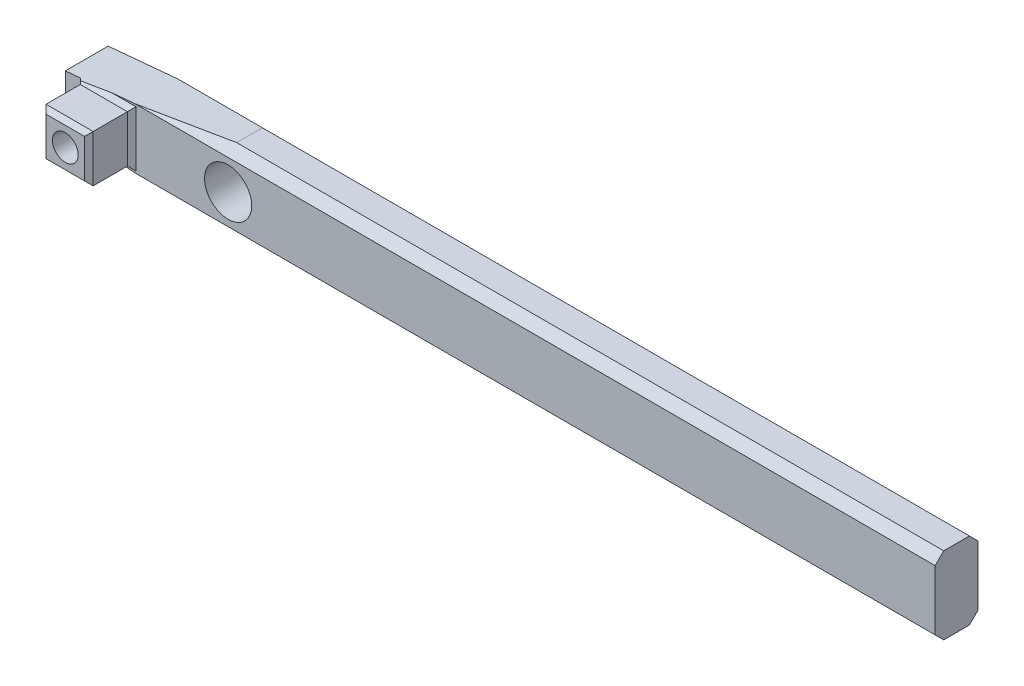
from build123d import *

# Parameters (mm, degrees)
SKETCH1_R           = 2.75
BOSS_EXTRUDE1_DEPTH = 5
CHAMFER1_SIZE       = 1
SKETCH2_R           = 1.5
CUT_EXTRUDE1_DEPTH  = 83.773788122
BOSS_EXTRUDE2_START = 5
SKETCH3_W           = 5.5
SKETCH3_H           = 5.5
SKETCH3_W_2         = 3
SKETCH3_H_2         = 3
BOSS_EXTRUDE2_DEPTH = 5
CHAMFER3_SIZE       = 0.5


with BuildPart() as part:
    # Sketch1 → Boss-Extrude1 (new body)
    with BuildSketch(Plane.XY):
        Polygon((82.5, 4.5), (82.5, -4.5), (0, -4.5), (-19, -2.75), (-19, 2.75), (0, 4.5), align=None)
        Circle(SKETCH1_R, mode=Mode.SUBTRACT)
    extrude(amount=BOSS_EXTRUDE1_DEPTH)

    # Chamfer1
    # the kernel refuses this chamfer: 1 mm, written as the material it takes off along each edge
    with BuildSketch(Plane(origin=(-12.85841494, 4.5, 5), x_dir=(0, 0, -1), z_dir=(1, 0, 0)), Plane(origin=(85.071682988, -4.5, 5), x_dir=(0, 0, -1), z_dir=(-1, 0, 0))) as chamfer1_piece_1:
        Polygon((CHAMFER1_SIZE, 0), (0, -CHAMFER1_SIZE), (0, 0), align=None)
    extrude(amount=97.930097928, mode=Mode.SUBTRACT)
    with BuildSketch(Plane(origin=(-12.85841494, 4.5, 0), x_dir=(0, 0, 1), z_dir=(1, 0, 0)), Plane(origin=(85.071682988, -4.5, 0), x_dir=(0, 0, 1), z_dir=(-1, 0, 0))) as chamfer1_piece_2:
        Polygon((CHAMFER1_SIZE, 0), (0, CHAMFER1_SIZE), (0, 0), align=None)
    extrude(amount=97.930097928, mode=Mode.SUBTRACT)

    # Sketch2 → Cut-Extrude1 (cut, through all)
    with BuildSketch(Plane.XY.offset(5)):
        with Locations((-14, 0)):
            Circle(SKETCH2_R)
    extrude(amount=-CUT_EXTRUDE1_DEPTH, mode=Mode.SUBTRACT)

    # Sketch3 → Boss-Extrude2 (add)
    # profile 1 of 5: a face of its own
    with BuildSketch(Plane.XY.offset(5).offset(BOSS_EXTRUDE2_START)):
        with Locations((-14, 0)):
            Rectangle(SKETCH3_W, SKETCH3_H)
        with Locations((-14, 0)):
            Rectangle(SKETCH3_W_2, SKETCH3_H_2, mode=Mode.SUBTRACT)
    # profile 2 of 5: a face of its own
    with BuildSketch(Plane.XY.offset(5).offset(BOSS_EXTRUDE2_START)):
        with BuildLine():
            Line((-15.5, 1.5), (-15.5, 3e-09))
            ThreePointArc((-15.5, 3e-09), (-15.060660171, 1.060660173), (-14, 1.5))
            Line((-14, 1.5), (-15.5, 1.5))
        make_face()
    # profile 3 of 5: a face of its own
    with BuildSketch(Plane.XY.offset(5).offset(BOSS_EXTRUDE2_START)):
        with BuildLine():
            Line((-15.5, 3e-09), (-15.5, -1.5))
            Line((-15.5, -1.5), (-14, -1.5))
            ThreePointArc((-14, -1.5), (-15.060660173, -1.060660171), (-15.5, 3e-09))
        make_face()
    # profile 4 of 5: a face of its own
    with BuildSketch(Plane.XY.offset(5).offset(BOSS_EXTRUDE2_START)):
        with BuildLine():
            ThreePointArc((-12.5, 0), (-12.939339828, -1.060660172), (-14, -1.5))
            Line((-14, -1.5), (-12.5, -1.5))
            Line((-12.5, -1.5), (-12.5, 0))
        make_face()
    # profile 5 of 5: a face of its own
    with BuildSketch(Plane.XY.offset(5).offset(BOSS_EXTRUDE2_START)):
        with BuildLine():
            ThreePointArc((-14, 1.5), (-12.939339828, 1.060660172), (-12.5, 0))
            Line((-12.5, 0), (-12.5, 1.5))
            Line((-12.5, 1.5), (-14, 1.5))
        make_face()
    extrude(amount=-BOSS_EXTRUDE2_DEPTH)

    # Chamfer3
    # the kernel refuses this chamfer: 0.5 mm, written as the material it adds along each edge
    with BuildSketch(Plane(origin=(-16.75, -2.75, 5), x_dir=(0, -1, 0), z_dir=(1, 0, 0))) as chamfer3_piece_1_section:
        Polygon((CHAMFER3_SIZE, 0), (0, -CHAMFER3_SIZE), (0, 0), align=None)
    chamfer3_piece_1 = extrude(amount=5.5, mode=Mode.PRIVATE)
    chamfer3_piece_1 = split(chamfer3_piece_1, bisect_by=Plane(origin=(-16.768927039, -2.955493562, 5), z_dir=(0.09171704949125846, 0.995785108762236, 0)), keep=Keep.TOP, mode=Mode.PRIVATE)
    add(chamfer3_piece_1)
    with BuildSketch(Plane(origin=(-11.25, -2.75, 5), x_dir=(1, 0, 0), z_dir=(0, 1, 0)), Plane(origin=(-16.75, 2.75, 5), x_dir=(-1, 0, 0), z_dir=(0, -1, 0))) as chamfer3_piece_2:
        Polygon((CHAMFER3_SIZE, 0), (0, -CHAMFER3_SIZE), (0, 0), align=None)
    extrude(amount=5.5)
    with BuildSketch(Plane(origin=(-11.25, 2.75, 5), x_dir=(0, 1, 0), z_dir=(-1, 0, 0))) as chamfer3_piece_3_section:
        Polygon((CHAMFER3_SIZE, 0), (0, -CHAMFER3_SIZE), (0, 0), align=None)
    chamfer3_piece_3 = extrude(amount=5.5, mode=Mode.PRIVATE)
    chamfer3_piece_3 = split(chamfer3_piece_3, bisect_by=Plane(origin=(-11.315193133, 3.457811159, 5), z_dir=(0.09171704949125607, -0.9957851087622361, 0)), keep=Keep.TOP, mode=Mode.PRIVATE)
    add(chamfer3_piece_3)
    with BuildSketch(Plane(origin=(-16.75, 2.75, 5), x_dir=(-1, 0, 0), z_dir=(0, -1, 0))) as chamfer3_piece_4a_section:
        Polygon((CHAMFER3_SIZE, 0), (0, -CHAMFER3_SIZE), (0, 0), align=None)
    chamfer3_piece_4a = extrude(amount=6.785841494, mode=Mode.PRIVATE)
    chamfer3_piece_4a = split(chamfer3_piece_4a, bisect_by=Plane(origin=(-17.271244635, -2.909227468, 5), z_dir=(0.09171704949125846, 0.995785108762236, 0)), keep=Keep.TOP, mode=Mode.PRIVATE)
    chamfer3_piece_4a = split(chamfer3_piece_4a, bisect_by=Plane(origin=(-16.75, -2.75, 5), z_dir=(0, -1, 0)), keep=Keep.TOP, mode=Mode.PRIVATE)
    with BuildSketch(Plane(origin=(-18.035841494, -2.75, 5), x_dir=(0, -1, 0), z_dir=(1, 0, 0))) as chamfer3_piece_4b_section:
        Polygon((CHAMFER3_SIZE, 0), (0, -CHAMFER3_SIZE), (0, 0), align=None)
    chamfer3_piece_4b = extrude(amount=6.785841494, mode=Mode.PRIVATE)
    chamfer3_piece_4b = split(chamfer3_piece_4b, bisect_by=Plane(origin=(-18.043952012, -2.838057052, 5), z_dir=(0.09171704949125846, 0.995785108762236, 0)), keep=Keep.TOP, mode=Mode.PRIVATE)
    chamfer3_piece_4b = split(chamfer3_piece_4b, bisect_by=Plane(origin=(-16.75, -2.75, 5), z_dir=(-1, 0, 0)), keep=Keep.TOP, mode=Mode.PRIVATE)
    chamfer3_piece_4 = chamfer3_piece_4a & chamfer3_piece_4b
    add(chamfer3_piece_4)
    with BuildSketch(Plane(origin=(-11.25, -4.035841494, 5), x_dir=(1, 0, 0), z_dir=(0, 1, 0))) as chamfer3_piece_5a_section:
        Polygon((CHAMFER3_SIZE, 0), (0, -CHAMFER3_SIZE), (0, 0), align=None)
    chamfer3_piece_5a = extrude(amount=6.785841494, mode=Mode.PRIVATE)
    chamfer3_piece_5a = split(chamfer3_piece_5a, bisect_by=Plane(origin=(-11.25, -3.767920747, 4.732079253), z_dir=(0, 0.7071067811865476, -0.7071067811865476)), keep=Keep.TOP, mode=Mode.PRIVATE)
    chamfer3_piece_5a = split(chamfer3_piece_5a, bisect_by=Plane(origin=(-11.197756622, -3.46862768, 5), z_dir=(0.09171704949125846, 0.995785108762236, 0)), keep=Keep.TOP, mode=Mode.PRIVATE)
    chamfer3_piece_5a = split(chamfer3_piece_5a, bisect_by=Plane(origin=(-11.25, -2.75, 5), z_dir=(0, -1, 0)), keep=Keep.TOP, mode=Mode.PRIVATE)
    with BuildSketch(Plane(origin=(-16.75, -2.75, 5), x_dir=(0, -1, 0), z_dir=(1, 0, 0))) as chamfer3_piece_5b_section:
        Polygon((CHAMFER3_SIZE, 0), (0, -CHAMFER3_SIZE), (0, 0), align=None)
    chamfer3_piece_5b = extrude(amount=6.785841494, mode=Mode.PRIVATE)
    chamfer3_piece_5b = split(chamfer3_piece_5b, bisect_by=Plane(origin=(-11.25, -2.75, 5), z_dir=(1, 0, 0)), keep=Keep.TOP, mode=Mode.PRIVATE)
    chamfer3_piece_5 = chamfer3_piece_5a & chamfer3_piece_5b
    add(chamfer3_piece_5)
    with BuildSketch(Plane(origin=(-9.964158506, 2.75, 5), x_dir=(0, 1, 0), z_dir=(-1, 0, 0))) as chamfer3_piece_6a_section:
        Polygon((CHAMFER3_SIZE, 0), (0, -CHAMFER3_SIZE), (0, 0), align=None)
    chamfer3_piece_6a = extrude(amount=6.785841494, mode=Mode.PRIVATE)
    chamfer3_piece_6a = split(chamfer3_piece_6a, bisect_by=Plane(origin=(-11.25, 2.75, 5), z_dir=(1, 0, 0)), keep=Keep.TOP, mode=Mode.PRIVATE)
    with BuildSketch(Plane(origin=(-11.25, -2.75, 5), x_dir=(1, 0, 0), z_dir=(0, 1, 0))) as chamfer3_piece_6b_section:
        Polygon((CHAMFER3_SIZE, 0), (0, -CHAMFER3_SIZE), (0, 0), align=None)
    chamfer3_piece_6b = extrude(amount=6.785841494, mode=Mode.PRIVATE)
    chamfer3_piece_6b = split(chamfer3_piece_6b, bisect_by=Plane(origin=(-11.25, 0.375, 8.125), z_dir=(0, -0.7071067811865476, -0.7071067811865476)), keep=Keep.TOP, mode=Mode.PRIVATE)
    chamfer3_piece_6b = split(chamfer3_piece_6b, bisect_by=Plane(origin=(-11.81751073, 3.411545064, 5), z_dir=(0.09171704949125607, -0.9957851087622361, 0)), keep=Keep.TOP, mode=Mode.PRIVATE)
    chamfer3_piece_6b = split(chamfer3_piece_6b, bisect_by=Plane(origin=(-11.25, 2.75, 5), z_dir=(0, 1, 0)), keep=Keep.TOP, mode=Mode.PRIVATE)
    chamfer3_piece_6 = chamfer3_piece_6a & chamfer3_piece_6b
    add(chamfer3_piece_6)
    with BuildSketch(Plane(origin=(-16.75, 4.035841494, 5), x_dir=(-1, 0, 0), z_dir=(0, -1, 0))) as chamfer3_piece_7a_section:
        Polygon((CHAMFER3_SIZE, 0), (0, -CHAMFER3_SIZE), (0, 0), align=None)
    chamfer3_piece_7a = extrude(amount=6.785841494, mode=Mode.PRIVATE)
    chamfer3_piece_7a = split(chamfer3_piece_7a, bisect_by=Plane(origin=(-16.651490528, 2.966310083, 5), z_dir=(0.09171704949125607, -0.9957851087622361, 0)), keep=Keep.TOP, mode=Mode.PRIVATE)
    chamfer3_piece_7a = split(chamfer3_piece_7a, bisect_by=Plane(origin=(-16.75, 2.75, 5), z_dir=(0, 1, 0)), keep=Keep.TOP, mode=Mode.PRIVATE)
    with BuildSketch(Plane(origin=(-11.25, 2.75, 5), x_dir=(0, 1, 0), z_dir=(-1, 0, 0))) as chamfer3_piece_7b_section:
        Polygon((CHAMFER3_SIZE, 0), (0, -CHAMFER3_SIZE), (0, 0), align=None)
    chamfer3_piece_7b = extrude(amount=6.785841494, mode=Mode.PRIVATE)
    chamfer3_piece_7b = split(chamfer3_piece_7b, bisect_by=Plane(origin=(-11.315193133, 3.457811159, 5), z_dir=(0.09171704949125607, -0.9957851087622361, 0)), keep=Keep.TOP, mode=Mode.PRIVATE)
    chamfer3_piece_7b = split(chamfer3_piece_7b, bisect_by=Plane(origin=(-16.75, 2.75, 5), z_dir=(-1, 0, 0)), keep=Keep.TOP, mode=Mode.PRIVATE)
    chamfer3_piece_7 = chamfer3_piece_7a & chamfer3_piece_7b
    add(chamfer3_piece_7)
    # the kernel refuses this chamfer: 0.5 mm, written as the material it takes off along each edge
    with BuildSketch(Plane(origin=(-9.964158506, 2.75, 10), x_dir=(0, 0, -1), z_dir=(-1, 0, 0)), Plane(origin=(-18.035841494, -2.75, 10), x_dir=(0, 0, -1), z_dir=(1, 0, 0)), Plane(origin=(-11.25, -4.035841494, 10), x_dir=(0, 0, -1), z_dir=(0, 1, 0))) as chamfer3_2_piece_1:
        Polygon((CHAMFER3_SIZE, 0), (0, CHAMFER3_SIZE), (0, 0), align=None)
    extrude(amount=8.071682988, mode=Mode.SUBTRACT)
    with BuildSketch(Plane(origin=(-16.75, 4.035841494, 10), x_dir=(1, 0, 0), z_dir=(0, -1, 0))) as chamfer3_2_piece_2:
        Polygon((CHAMFER3_SIZE, 0), (0, -CHAMFER3_SIZE), (0, 0), align=None)
    extrude(amount=8.071682988, mode=Mode.SUBTRACT)


solid = part.part
